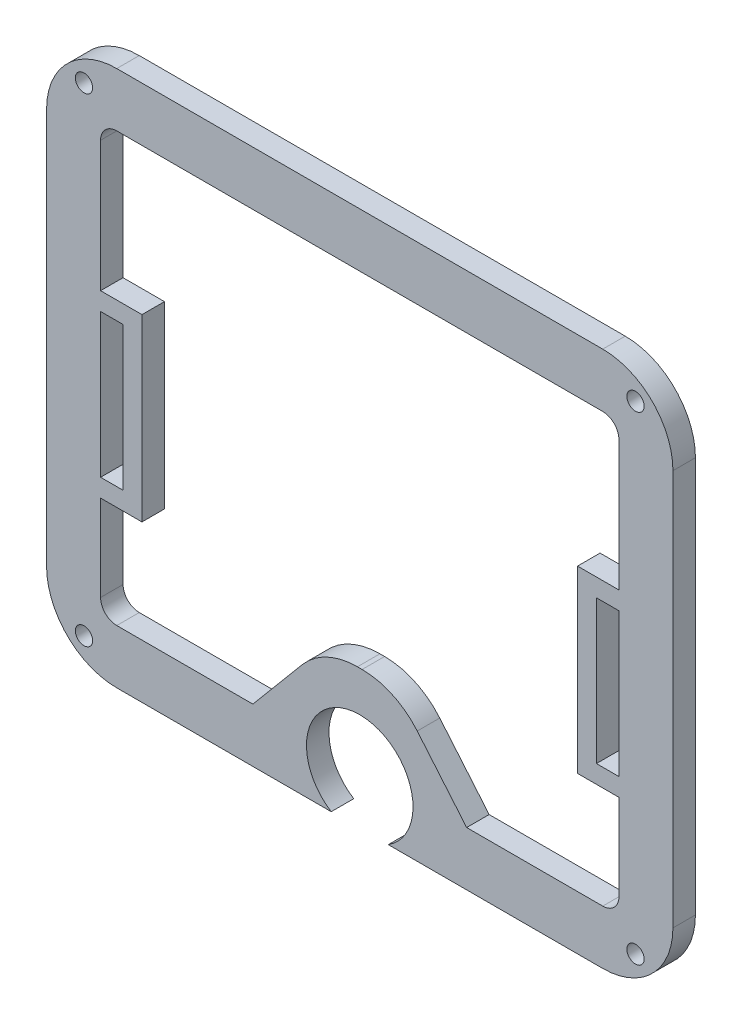
from build123d import *

# Parameters (mm, degrees)
SKETCH1_R           = 0.6096
BOSS_EXTRUDE1_DEPTH = 1.5875
SKETCH2_W           = 1.5875
SKETCH2_H           = 12.671140923
BOSS_EXTRUDE2_DEPTH = 2.921
CUT_EXTRUDE1_DEPTH  = 1.5875


with BuildPart() as part:
    # Sketch1 → Boss-Extrude1 (new body)
    with BuildSketch(Plane.XY):
        with BuildLine():
            Line((-17.145, -18.923), (-2.01269959, -18.923))
            ThreePointArc((-2.01269959, -18.923), (0, -11.9888), (2.01269959, -18.923))
            Line((2.01269959, -18.923), (17.145, -18.923))
            ThreePointArc((17.145, -18.923), (20.647299887, -17.472299887), (22.098, -13.97))
            Line((22.098, -13.97), (22.098, 13.97))
            ThreePointArc((22.098, 13.97), (20.647299887, 17.472299887), (17.145, 18.923))
            Line((17.145, 18.923), (-17.145, 18.923))
            ThreePointArc((-17.145, 18.923), (-20.647299887, 17.472299887), (-22.098, 13.97))
            Line((-22.098, 13.97), (-22.098, -13.97))
            ThreePointArc((-22.098, -13.97), (-20.647299887, -17.472299887), (-17.145, -18.923))
        make_face()
        with Locations((-19.457528855, 16.891)):
            Circle(SKETCH1_R, mode=Mode.SUBTRACT)
        with Locations((19.457528855, 16.891)):
            Circle(SKETCH1_R, mode=Mode.SUBTRACT)
        with Locations((19.457528855, -16.891)):
            Circle(SKETCH1_R, mode=Mode.SUBTRACT)
        with Locations((-19.457528855, -16.891)):
            Circle(SKETCH1_R, mode=Mode.SUBTRACT)
        with BuildLine():
            Line((-18.288, 13.97), (-18.288, -13.97))
            ThreePointArc((-18.288, -13.97), (-17.953223051, -14.778223051), (-17.145, -15.113))
            Line((-17.145, -15.113), (-7.542517063, -15.113))
            Line((-7.542517063, -15.113), (-4.056594232, -10.958638943))
            ThreePointArc((-4.056594232, -10.958638943), (-2.31198923, -9.619956442), (-0.165088461, -9.144))
            Line((-0.165088461, -9.144), (0.165088461, -9.144))
            ThreePointArc((0.165088461, -9.144), (2.31198923, -9.619956442), (4.056594232, -10.958638943))
            Line((4.056594232, -10.958638943), (7.542517063, -15.113))
            Line((7.542517063, -15.113), (17.145, -15.113))
            ThreePointArc((17.145, -15.113), (17.953223051, -14.778223051), (18.288, -13.97))
            Line((18.288, -13.97), (18.288, 13.97))
            ThreePointArc((18.288, 13.97), (17.953223051, 14.778223051), (17.145, 15.113))
            Line((17.145, 15.113), (-17.145, 15.113))
            ThreePointArc((-17.145, 15.113), (-17.953223051, 14.778223051), (-18.288, 13.97))
        make_face(mode=Mode.SUBTRACT)
    extrude(amount=BOSS_EXTRUDE1_DEPTH)

    # Sketch2 → Boss-Extrude2 (add)
    with BuildSketch(Plane(origin=(-18.288, 0, 0), x_dir=(0, 0, -1), z_dir=(1, 0, 0))):
        with Locations((-0.79375, -1.55941177)):
            Rectangle(SKETCH2_W, SKETCH2_H)
    boss_extrude2 = extrude(amount=BOSS_EXTRUDE2_DEPTH)

    # Sketch2<3> → Cut-Extrude1 (cut)
    with BuildSketch(Plane(origin=(-18.288, 0, 0), x_dir=(0, 0, -1), z_dir=(1, 0, 0))):
        Polygon((0, 1.60110436), (0, 3.506158692), (-1.5875, 3.506158692), (-1.5875, -6.624982231), (0, -6.624982231), align=None)
    cut_extrude1 = extrude(amount=CUT_EXTRUDE1_DEPTH, mode=Mode.SUBTRACT)

    # Mirror1: Boss-Extrude2, Cut-Extrude1 across plane
    add(boss_extrude2.mirror(Plane(origin=(0, 0, 0), x_dir=(0, 0, 1), z_dir=(1, 0, 0))))
    add(cut_extrude1.mirror(Plane(origin=(0, 0, 0), x_dir=(0, 0, 1), z_dir=(1, 0, 0))), mode=Mode.SUBTRACT)


solid = part.part
